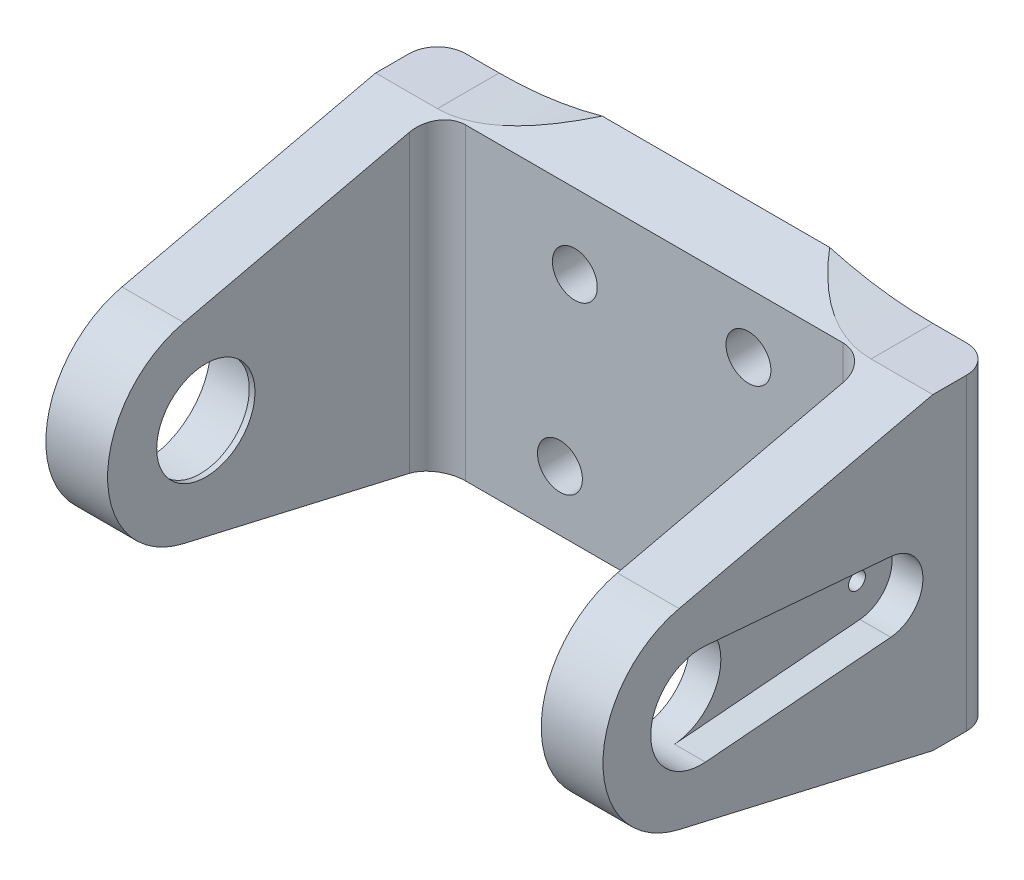
from build123d import *

# Parameters (mm, degrees)
Y_KSEKLIK_EKSTR_ZYON1_DEPTH = 14
KES_EKSTR_ZYON1_DEPTH       = 33.044227249
KES_EKSTR_ZYON3_DEPTH       = 33.044227249
KES_EKSTR_ZYON4_START       = -4.4
KES_EKSTR_ZYON4_DEPTH       = 4.4
KES_EKSTR_ZYON6_REACH       = 48.442
IZIM6_R                     = 3.6
IZIM5_R                     = 1.6
KES_EKSTR_ZYON5_DEPTH       = 37.282674929
KES_EKSTR_ZYON7_DEPTH       = 2.2
KES_EKSTR_ZYON8_REACH       = 46.576
IZIM7_R                     = 0.6
KES_EKSTR_ZYON10_REACH      = 48.442
IZIM9_R                     = 3.5
IZIM9_3_R                   = 4.75
IZIM9_3_R_2                 = 3.5
KES_EKSTR_ZYON11_DEPTH      = 4
RADYUS1_R                   = 2
IZIM5_3_R                   = 4
KES_EKSTR_ZYON12_DEPTH      = 3
PAH1_SIZE                   = 1.5


# Read off the part's stored shape, not the designer's step: Kes-Ekstrüzyon4
with BuildPart() as part:
    # Çizim1 → Yükseklik-Ekstrüzyon1 (new, symmetric)
    with BuildSketch(Plane(origin=(0, 0, 0), x_dir=(1, 0, 0), z_dir=(0, 1, 0))):
        Polygon((-19.85, -7), (-19.85, 20.9), (19.85, 20.9), (19.85, -7), (15.45, -7), (15.45, 16.5), (-15.45, 16.5), (-15.45, -7), align=None)
    extrude(amount=Y_KSEKLIK_EKSTR_ZYON1_DEPTH, both=True)

    # Çizim2 → Kes-Ekstrüzyon1 (cut, through all)
    with BuildSketch(Plane(origin=(0, 0, 0), x_dir=(0, 0, -1), z_dir=(1, 0, 0))):
        with BuildLine():
            Line((20.9, -12), (-1.571984828, -6.821206909))
            ThreePointArc((-1.571984828, -6.821206909), (-5.477403299, -4.358675613), (-7, 0))
            Line((-7, 0), (-7, -14))
            Line((-7, -14), (20.9, -14))
            Line((20.9, -14), (20.9, -12))
        make_face()
        with BuildLine():
            Line((-7, 14), (-7, 0))
            ThreePointArc((-7, 0), (-5.477403299, 4.358675613), (-1.571984828, 6.821206909))
            Line((-1.571984828, 6.821206909), (20.9, 12))
            Line((20.9, 12), (20.9, 14))
            Line((20.9, 14), (-7, 14))
        make_face()
    extrude(amount=-KES_EKSTR_ZYON1_DEPTH, mode=Mode.SUBTRACT)

    # Çizim3 → Kes-Ekstrüzyon3 (cut, through all)
    with BuildSketch(Plane(origin=(0, 0, 0), x_dir=(0, 0, -1), z_dir=(1, 0, 0))):
        with BuildLine():
            ThreePointArc((-7, 3e-09), (-5.477403298, 4.358675614), (-1.571984828, 6.821206909))
            Line((-1.571984828, 6.821206909), (20.9, 12))
            Line((20.9, 12), (20.9, 14))
            Line((20.9, 14), (-7, 14))
            Line((-7, 14), (-7, 3e-09))
        make_face()
        with BuildLine():
            ThreePointArc((-1.571984828, -6.821206909), (-5.4774033, -4.358675612), (-7, 3e-09))
            Line((-7, 3e-09), (-7, -14))
            Line((-7, -14), (20.9, -14))
            Line((20.9, -14), (20.9, -12))
            Line((20.9, -12), (-1.571984828, -6.821206909))
        make_face()
    extrude(amount=KES_EKSTR_ZYON3_DEPTH, mode=Mode.SUBTRACT)

    # Kes-Ekstrüzyon4 outline → Kes-Ekstrüzyon4 (cut)
    with BuildSketch(Plane.XY.offset(-16.5).offset(KES_EKSTR_ZYON4_START)):
        with BuildLine():
            Line((-19.85, 10.985995684), (-15.45, 10.985995684))
            ThreePointArc((-15.45, 10.985995684), (-10.259984059, 11.487506015), (-5.262018305, 12.973479231))
            ThreePointArc((-5.262018305, 12.973479231), (-2.680605384, 13.740973574), (5.9e-08, 14))
            Line((5.9e-08, 14), (-19.85, 14))
            Line((-19.85, 14), (-19.85, 10.985995684))
        make_face()
        with BuildLine():
            ThreePointArc((-5.262018305, -12.973479231), (-10.259984059, -11.487506015), (-15.45, -10.985995684))
            Line((-15.45, -10.985995684), (-19.85, -10.985995684))
            Line((-19.85, -10.985995684), (-19.85, -14))
            Line((-19.85, -14), (0, -14))
            ThreePointArc((0, -14), (-2.680605414, -13.740973569), (-5.262018305, -12.973479231))
        make_face()
        with BuildLine():
            Line((19.85, 14), (5.9e-08, 14))
            ThreePointArc((5.9e-08, 14), (2.680605443, 13.740973563), (5.262018305, 12.973479231))
            ThreePointArc((5.262018305, 12.973479231), (10.259984059, 11.487506015), (15.45, 10.985995684))
            Line((15.45, 10.985995684), (19.85, 10.985995684))
            Line((19.85, 10.985995684), (19.85, 14))
        make_face()
        with BuildLine():
            ThreePointArc((5.262018305, -12.973479231), (2.680605414, -13.740973569), (0, -14))
            Line((0, -14), (19.85, -14))
            Line((19.85, -14), (19.85, -10.985995684))
            Line((19.85, -10.985995684), (15.45, -10.985995684))
            ThreePointArc((15.45, -10.985995684), (10.259984059, -11.487506015), (5.262018305, -12.973479231))
        make_face()
    extrude(amount=KES_EKSTR_ZYON4_DEPTH, mode=Mode.SUBTRACT)

    # Çizim6 → Kes-Ekstrüzyon6 (cut, up to next)
    with BuildSketch(Plane(origin=(19.85, 0, 0), x_dir=(0, 0, -1), z_dir=(1, 0, 0)), mode=Mode.PRIVATE) as kes_ekstr_zyon6_sk1:
        Circle(IZIM6_R)
    kes_ekstr_zyon6_tool1 = extrude(kes_ekstr_zyon6_sk1.sketch, amount=-KES_EKSTR_ZYON6_REACH, mode=Mode.PRIVATE) & part.part
    add(kes_ekstr_zyon6_tool1.solids().sort_by_distance((19.85, 0, 0))[0], mode=Mode.SUBTRACT)

    # Çizim5 → Kes-Ekstrüzyon5 (cut, through all)
    with BuildSketch(Plane(origin=(0, 0, -20.9), x_dir=(-1, 0, 0), z_dir=(0, 0, -1))):
        with Locations((-5.656854249, -5.656854249)):
            Circle(IZIM5_R)
        with Locations((-6.717514421, 6.717514421)):
            Circle(IZIM5_R)
        with Locations((5.656854249, 5.656854249)):
            Circle(IZIM5_R)
        with Locations((6.717514421, -6.717514421)):
            Circle(IZIM5_R)
    extrude(amount=-KES_EKSTR_ZYON5_DEPTH, mode=Mode.SUBTRACT)

    # Çizim6<3> → Kes-Ekstrüzyon7 (cut)
    with BuildSketch(Plane(origin=(19.85, 0, 0), x_dir=(0, 0, -1), z_dir=(1, 0, 0))):
        with BuildLine():
            ThreePointArc((0.297744361, 3.587666135), (3.6, 0), (0.297744361, -3.587666135))
            Line((0.297744361, -3.587666135), (13.506766917, -2.491434816))
            ThreePointArc((13.506766917, -2.491434816), (15.8, 0), (13.506766917, 2.491434816))
            Line((13.506766917, 2.491434816), (0.297744361, 3.587666135))
        make_face()
    extrude(amount=-KES_EKSTR_ZYON7_DEPTH, mode=Mode.SUBTRACT)

    # Çizim7 → Kes-Ekstrüzyon8 (cut, up to next)
    with BuildSketch(Plane(origin=(17.65, 0, 0), x_dir=(0, 0, -1), z_dir=(1, 0, 0)), mode=Mode.PRIVATE) as kes_ekstr_zyon8_sk1:
        with Locations((13.3, 0)):
            Circle(IZIM7_R)
    kes_ekstr_zyon8_tool1 = extrude(kes_ekstr_zyon8_sk1.sketch, amount=-KES_EKSTR_ZYON8_REACH, mode=Mode.PRIVATE) & part.part
    add(kes_ekstr_zyon8_tool1.solids().sort_by_distance((17.65, 0, -13.3))[0], mode=Mode.SUBTRACT)

    # Çizim9 → Kes-Ekstrüzyon10 (cut, up to next)
    with BuildSketch(Plane.ZY.offset(19.85), mode=Mode.PRIVATE) as kes_ekstr_zyon10_sk1:
        Circle(IZIM9_R)
    kes_ekstr_zyon10_tool1 = extrude(kes_ekstr_zyon10_sk1.sketch, amount=-KES_EKSTR_ZYON10_REACH, mode=Mode.PRIVATE) & part.part
    add(kes_ekstr_zyon10_tool1.solids().sort_by_distance((-19.85, 0, 0))[0], mode=Mode.SUBTRACT)

    # Çizim9<3> → Kes-Ekstrüzyon11 (cut)
    with BuildSketch(Plane.ZY.offset(19.85)):
        Circle(IZIM9_3_R)
        Circle(IZIM9_3_R_2, mode=Mode.SUBTRACT)
    extrude(amount=-KES_EKSTR_ZYON11_DEPTH, mode=Mode.SUBTRACT)

    # Radyus1
    # the kernel refuses this fillet: 2 mm, written as the material it adds along each edge
    with BuildSketch(Plane(origin=(-15.45, -15.985995684, -16.5), x_dir=(0, 0, 1), z_dir=(0, 1, 0))) as radyus1_piece_1_section:
        with BuildLine():
            CenterArc((RADYUS1_R, RADYUS1_R), RADYUS1_R, 180, 90)
            Line((0, RADYUS1_R), (0, 0))
            Line((0, 0), (RADYUS1_R, 0))
        make_face()
    radyus1_piece_1 = extrude(amount=31.971991369, mode=Mode.PRIVATE)
    radyus1_piece_1 = split(radyus1_piece_1, bisect_by=Plane(origin=(-14.994883818, 10.333733048, -13.66968108), z_dir=(0, -0.9744581299008602, -0.22456926118709647)), keep=Keep.TOP, mode=Mode.PRIVATE)
    radyus1_piece_1 = split(radyus1_piece_1, bisect_by=Plane(origin=(-14.994883818, -10.333733048, -13.66968108), z_dir=(0, 0.9744581299008602, -0.22456926118709647)), keep=Keep.TOP, mode=Mode.PRIVATE)
    add(radyus1_piece_1)
    with BuildSketch(Plane(origin=(15.45, 15.985995684, -16.5), x_dir=(-1, 0, 0), z_dir=(0, -1, 0))) as radyus1_piece_2_section:
        with BuildLine():
            CenterArc((RADYUS1_R, -RADYUS1_R), RADYUS1_R, 90, 90)
            Line((0, -RADYUS1_R), (0, 0))
            Line((0, 0), (RADYUS1_R, 0))
        make_face()
    radyus1_piece_2 = extrude(amount=31.971991369, mode=Mode.PRIVATE)
    radyus1_piece_2 = split(radyus1_piece_2, bisect_by=Plane(origin=(14.994883818, -10.333733048, -13.66968108), z_dir=(0, 0.9744581299008602, -0.22456926118709647)), keep=Keep.TOP, mode=Mode.PRIVATE)
    radyus1_piece_2 = split(radyus1_piece_2, bisect_by=Plane(origin=(14.994883818, 10.333733048, -13.66968108), z_dir=(0, -0.9744581299008602, -0.22456926118709647)), keep=Keep.TOP, mode=Mode.PRIVATE)
    add(radyus1_piece_2)
    # the kernel refuses this fillet: 2 mm, written as the material it takes off along each edge
    with BuildSketch(Plane(origin=(-19.85, 15.985995684, -20.9), x_dir=(0, 0, 1), z_dir=(0, -1, 0)), Plane(origin=(19.85, 15.985995684, -20.9), x_dir=(-1, 0, 0), z_dir=(0, -1, 0))) as radyus1_2_piece_1:
        with BuildLine():
            CenterArc((RADYUS1_R, -RADYUS1_R), RADYUS1_R, 90, 90)
            Line((0, -RADYUS1_R), (0, 0))
            Line((0, 0), (RADYUS1_R, 0))
        make_face()
    extrude(amount=31.971991368, mode=Mode.SUBTRACT)

    # Çizim5<3> → Kes-Ekstrüzyon12 (cut)
    with BuildSketch(Plane(origin=(0, 0, -20.9), x_dir=(-1, 0, 0), z_dir=(0, 0, -1))):
        Circle(IZIM5_3_R)
    extrude(amount=-KES_EKSTR_ZYON12_DEPTH, mode=Mode.SUBTRACT)

    # Pah1
    pah1_edges = [part.edges().sort_by_distance(p)[0] for p in [
        (4, 0, -17.9),
    ]]
    chamfer(pah1_edges, length=PAH1_SIZE)


solid = part.part
